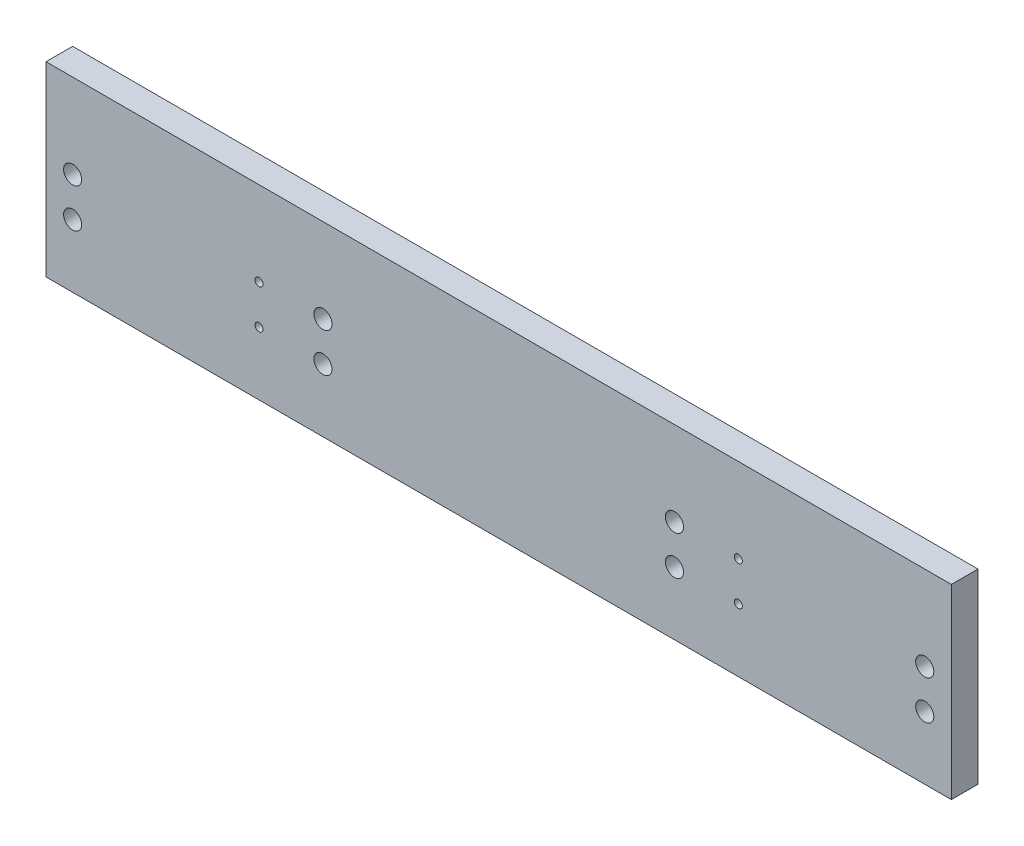
from build123d import *

# Parameters (mm, degrees)
SKETCH1_W                    = 340
SKETCH1_H                    = 70
BOSS_EXTRUDE1_DEPTH          = 10
M8_TAPPED_HOLE1_D            = 6.8
M8_TAPPED_HOLE1_DEPTH        = 69.999
M8_TAPPED_HOLE1_TIP          = 2.042926105
M8_TAPPED_HOLE2_D            = 6.8
M8_TAPPED_HOLE2_DEPTH        = 69.999
M8_TAPPED_HOLE2_TIP          = 2.042926105
F_3_0_3_DIAMETER_HOLE1_D     = 3
F_3_0_3_DIAMETER_HOLE1_DEPTH = 30
F_3_0_3_DIAMETER_HOLE1_TIP   = 0.901290929
F_3_0_3_DIAMETER_HOLE2_D     = 3
F_3_0_3_DIAMETER_HOLE2_DEPTH = 30
F_3_0_3_DIAMETER_HOLE2_TIP   = 0.901290929


with BuildPart() as part:
    # Sketch1 → Boss-Extrude1 (new body)
    with BuildSketch(Plane.XY):
        with Locations((100, 28)):
            Rectangle(SKETCH1_W, SKETCH1_H)
    extrude(amount=BOSS_EXTRUDE1_DEPTH)

    # M8 Tapped Hole1
    with Locations(Plane(origin=(99.658904688, 53.985495885, 20), x_dir=(1, 0, 0), z_dir=(0, 0, 1))):
        with Locations((-159.658904688, -22.652162552), (-159.658904688, -37.318829219), (-65.658904688, -22.652162552), (-65.658904688, -37.318829219), (66.341095312, -22.652162552), (66.341095312, -37.318829219), (160.341095312, -22.652162552), (160.341095312, -37.318829219)):
            Hole(M8_TAPPED_HOLE1_D / 2, depth=M8_TAPPED_HOLE1_DEPTH)
            with Locations((0, 0, -(M8_TAPPED_HOLE1_DEPTH + M8_TAPPED_HOLE1_TIP / 2))):  # 118° drill point
                Cone(0, M8_TAPPED_HOLE1_D / 2, M8_TAPPED_HOLE1_TIP, mode=Mode.SUBTRACT)

    # M8 Tapped Hole2
    with Locations(Plane(origin=(100.341095312, 53.985495885, 0), x_dir=(-1, 0, 0), z_dir=(0, 0, -1))):
        with Locations((-159.658904688, -22.652162552), (-159.658904688, -37.318829219), (-65.658904688, -22.652162552), (-65.658904688, -37.318829219), (66.341095312, -22.652162552), (66.341095312, -37.318829219), (160.341095312, -22.652162552), (160.341095312, -37.318829219)):
            Hole(M8_TAPPED_HOLE2_D / 2, depth=M8_TAPPED_HOLE2_DEPTH)
            with Locations((0, 0, -(M8_TAPPED_HOLE2_DEPTH + M8_TAPPED_HOLE2_TIP / 2))):  # 118° drill point
                Cone(0, M8_TAPPED_HOLE2_D / 2, M8_TAPPED_HOLE2_TIP, mode=Mode.SUBTRACT)

    # Ø3.0 (3) Diameter Hole1
    with Locations(Plane(origin=(99.658904688, 53.985495885, 20), x_dir=(1, 0, 0), z_dir=(0, 0, 1))):
        with Locations((-89.658904688, -22.652162552), (-89.658904688, -37.318829219), (90.341095312, -22.652162552), (90.341095312, -37.318829219)):
            Hole(F_3_0_3_DIAMETER_HOLE1_D / 2, depth=F_3_0_3_DIAMETER_HOLE1_DEPTH)
            with Locations((0, 0, -(F_3_0_3_DIAMETER_HOLE1_DEPTH + F_3_0_3_DIAMETER_HOLE1_TIP / 2))):  # 118° drill point
                Cone(0, F_3_0_3_DIAMETER_HOLE1_D / 2, F_3_0_3_DIAMETER_HOLE1_TIP, mode=Mode.SUBTRACT)

    # Ø3.0 (3) Diameter Hole2
    with Locations(Plane(origin=(100.341095312, 53.985495885, 0), x_dir=(-1, 0, 0), z_dir=(0, 0, -1))):
        with Locations((-89.658904688, -22.652162552), (-89.658904688, -37.318829219), (90.341095312, -22.652162552), (90.341095312, -37.318829219)):
            Hole(F_3_0_3_DIAMETER_HOLE2_D / 2, depth=F_3_0_3_DIAMETER_HOLE2_DEPTH)
            with Locations((0, 0, -(F_3_0_3_DIAMETER_HOLE2_DEPTH + F_3_0_3_DIAMETER_HOLE2_TIP / 2))):  # 118° drill point
                Cone(0, F_3_0_3_DIAMETER_HOLE2_D / 2, F_3_0_3_DIAMETER_HOLE2_TIP, mode=Mode.SUBTRACT)


solid = part.part
